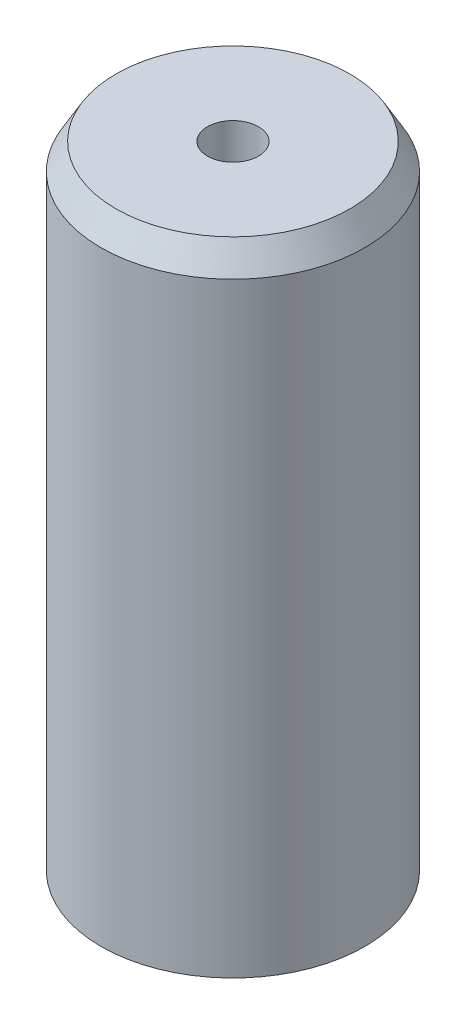
from build123d import *
from OCP.BRepFilletAPI import BRepFilletAPI_MakeChamfer

# Parameters (mm, degrees)
SKETCH1_R           = 5
BOSS_EXTRUDE1_DEPTH = 24.484356247
SKETCH2_R           = 0.966676824
CUT_EXTRUDE1_DEPTH  = 26.484970097
CHAMFER1_SIZE       = 0.987778532
CHAMFER1_SIZE2      = 0.570294201


with BuildPart() as part:
    # Sketch1 → Boss-Extrude1 (new body)
    with BuildSketch(Plane(origin=(0, 0, 0), x_dir=(1, 0, 0), z_dir=(0, 1, 0))):
        Circle(SKETCH1_R)
    extrude(amount=BOSS_EXTRUDE1_DEPTH)

    # Sketch2 → Cut-Extrude1 (cut, through all)
    with BuildSketch(Plane(origin=(0, 0, 0), x_dir=(1, 0, 0), z_dir=(0, 1, 0))):
        Circle(SKETCH2_R)
    extrude(amount=CUT_EXTRUDE1_DEPTH, mode=Mode.SUBTRACT)

    # Chamfer1: one chamfer whose edges measure the first distance from different faces: ONE call of the kernel's chamfer builder (chamfer() names one face for all edges)
    chamfer1_edges_1 = [part.edges().sort_by_distance(p)[0] for p in [
        (-5, 24.484356247, 0),
    ]]
    chamfer1_side_1 = [part.faces().sort_by_distance(p)[0] for p in [
        (-5, 12.242178124, 0),
    ]]
    chamfer1_edges_2 = [part.edges().sort_by_distance(p)[0] for p in [
        (-5, 0, 0),
    ]]
    chamfer1_side_2 = [part.faces().sort_by_distance(p)[0] for p in [
        (-4.858578644, 0, 0),
    ]]
    chamfer1 = BRepFilletAPI_MakeChamfer(part.part.solid().wrapped)
    for e in chamfer1_edges_1:
        chamfer1.Add(CHAMFER1_SIZE, CHAMFER1_SIZE2, e.wrapped, chamfer1_side_1[0].wrapped)  # the first distance lies on this face
    for e in chamfer1_edges_2:
        chamfer1.Add(CHAMFER1_SIZE, CHAMFER1_SIZE2, e.wrapped, chamfer1_side_2[0].wrapped)  # the first distance lies on this face
    add(Compound.cast(chamfer1.Shape()), mode=Mode.REPLACE)


solid = part.part
